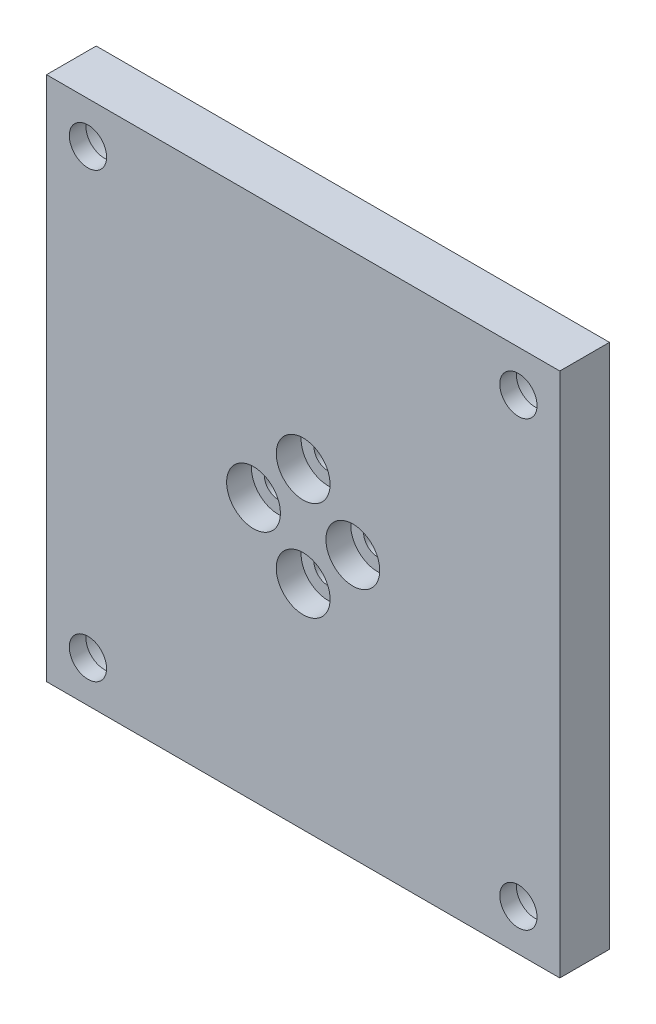
from build123d import *

# Parameters (mm, degrees)
SKETCH_1_W                  = 62
SKETCH_1_H                  = 63.5
EXTRUDE_1_DEPTH             = 6
HOLE_WIZARD_M31_D           = 3.4
HOLE_WIZARD_M31_CBORE_D     = 6.5
HOLE_WIZARD_M31_CBORE_DEPTH = 3
HOLE_WIZARD_M41_D           = 4.5
HOLE_WIZARD_M41_CBORE_D     = 8
HOLE_WIZARD_M41_CBORE_DEPTH = 4


with BuildPart() as part:
    # Эскиз1 → Бобышка-Вытянуть1 (new body)
    with BuildSketch(Plane.XY):
        Rectangle(SKETCH_1_W, SKETCH_1_H)
    extrude(amount=EXTRUDE_1_DEPTH)

    # Цековка для винта с внутренним шестигранником M31 (through all)
    with Locations(Plane.XY.offset(6)):
        with Locations((0, 6), (-6, 0), (0, -6), (6, 0)):
            CounterBoreHole(HOLE_WIZARD_M31_D / 2, HOLE_WIZARD_M31_CBORE_D / 2, HOLE_WIZARD_M31_CBORE_DEPTH)

    # Цековка для винта с внутренним шестигранником M41 (through all)
    with Locations(Plane(origin=(0, 0, 0), x_dir=(-1, 0, 0), z_dir=(0, 0, -1))):
        with Locations((-26, 26.75), (-26, -26.75), (26, -26.75), (26, 26.75)):
            CounterBoreHole(HOLE_WIZARD_M41_D / 2, HOLE_WIZARD_M41_CBORE_D / 2, HOLE_WIZARD_M41_CBORE_DEPTH)


solid = part.part
